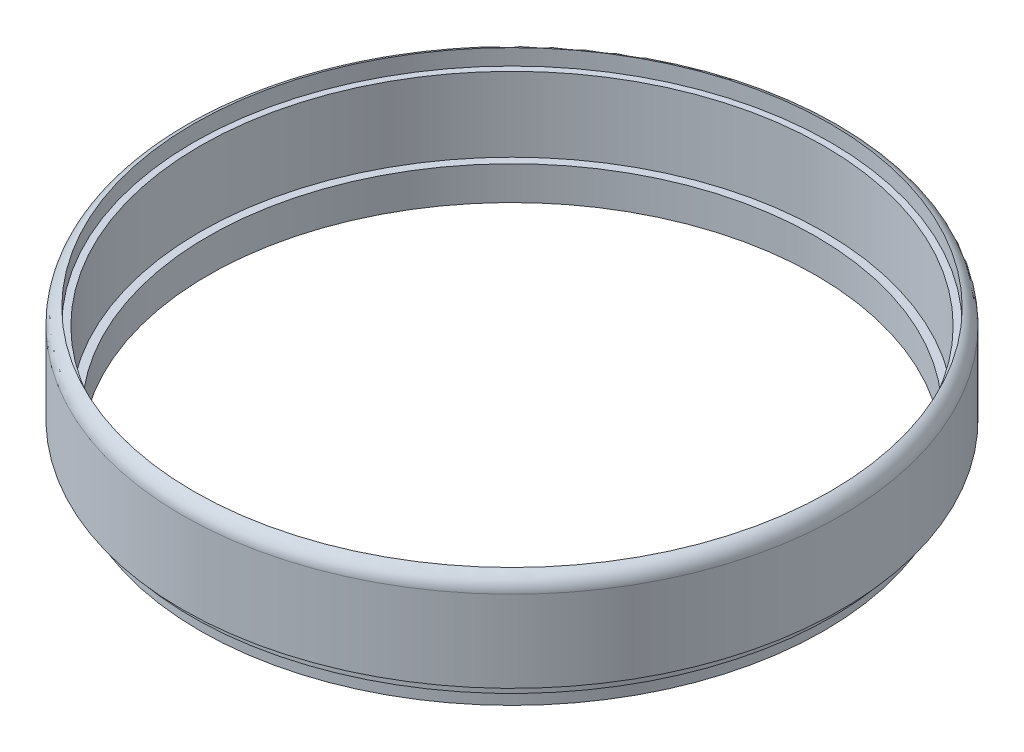
from build123d import *

# Parameters (mm, degrees)
CONG_1_R = 1


with BuildPart() as part:
    # Esquisse1 → Révolution1 (revolve)
    with BuildSketch(Plane.XY, mode=Mode.PRIVATE) as r_volution1_sk:
        Polygon((19, 2.1), (19, 0), (19.5, 0), (19.5, 1), (20, 1), (20, 1.7), (20.6, 1.7), (20.6, 7.75), (19.9, 7.75), (19.9, 6.75), (19.5, 6.75), (19.5, 2.1), align=None)
    revolve(r_volution1_sk.sketch.rotate(Axis((0, 0, 0), (0, 1, 0)), 90), axis=Axis((0, 0, 0), (0, 1, 0)))

    # Congé1
    # the kernel refuses this fillet: 1 mm, written as the material it takes off along each edge
    with BuildSketch(Plane(origin=(0, 7.75, 0), x_dir=(0, 0, -1), z_dir=(1, 0, 0))) as cong_1_piece_1:
        with BuildLine():
            CenterArc((19.6, -0.953939201), CONG_1_R, 0, 72.542396876)
            Line((19.9, 0), (19.906, 0.019078784))
            ThreePointArc((19.906, 0.019078784), (20.25, 0.02), (20.6, 0.02))
            Line((20.6, 0.02), (20.62, 0))
            Line((20.62, 0), (20.62, -0.953939201))
            Line((20.62, -0.953939201), (20.6, -0.953939201))
        make_face()
    revolve(axis=Axis((0, 7.75, 0), (0, 1, 0)), mode=Mode.SUBTRACT)


solid = part.part
